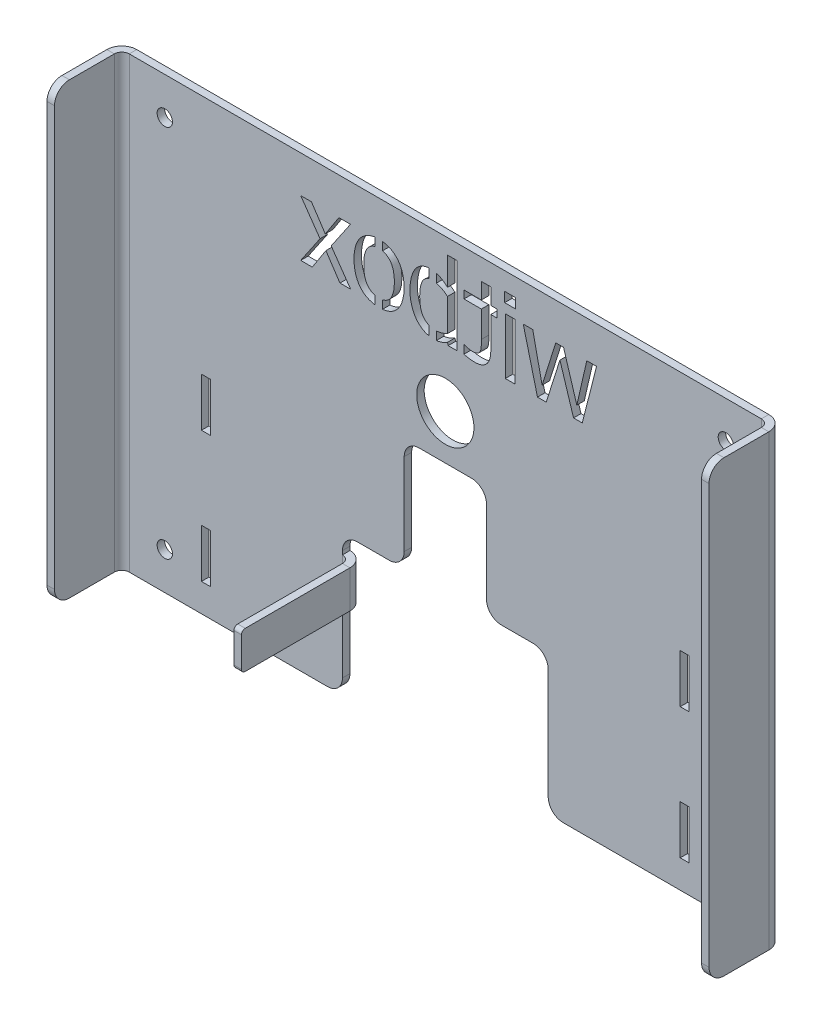
from build123d import *
from build123d.topology import SkipClean

# Parameters (mm, degrees)
SKETCH1_W                = 210.425
SKETCH1_H                = 120
BOSS_EXTRUDE1_DEPTH      = 2
FILLET1_R                = 4
CUT_EXTRUDE1_DEPTH       = 2
SKETCH3_R                = 2.05
SKETCH3_R_2              = 7.65
SKETCH3_W                = 2.4
SKETCH3_H                = 13
CUT_EXTRUDE2_DEPTH       = 2
SKETCHED_START           = -105.2125
SKETCHED_BEND1_OUTLINE_W = 120
SKETCHED_BEND1_OUTLINE_H = 2
SKETCHED_BEND1_DEPTH     = 17.09002
SKETCHED_START_2         = -86.52248
SKETCHED_BEND1_2_DEPTH   = 0.02248
SKETCHED_START_3         = -88.5
SKETCHED_BEND1_3_DEPTH   = 4
SKETCHED_START_4         = -60
SKETCHED_BEND1_4_DEPTH   = 121
SKETCHED_START_5         = 88.07752
SKETCHED_BEND2_OUTLINE_W = 120
SKETCHED_BEND2_OUTLINE_H = 2
SKETCHED_BEND2_DEPTH     = 17.13498
SKETCHED_START_6         = 86.5
SKETCHED_BEND2_2_DEPTH   = 0.26106225
SKETCHED_START_7         = 84.5
SKETCHED_BEND2_3_DEPTH   = 4
SKETCHED_BEND2_4_DEPTH   = 121
SKETCHED_START_8         = -37.5
SKETCHED_BEND3_DEPTH     = 10
SKETCHED_START_9         = -36.5
SKETCHED_BEND3_2_DEPTH   = 8
SKETCHED_START_10        = -27.12248
SKETCHED_BEND3_3_DEPTH   = 3.62248
SKETCHED_START_11        = -27.5
SKETCHED_BEND3_4_DEPTH   = 1.974011807
SKETCHED_BEND3_5_DEPTH   = 10
SKETCHED_START_12        = -28.5
SKETCHED_BEND3_6_DEPTH   = 1
SKETCH14_W               = 2.528363047
SKETCH14_H               = 15.008103727
SKETCH14_W_2             = 2.868719611
SKETCH14_H_2             = 2.625607779
CUT_EXTRUDE3_DEPTH       = 2
CUT_EXTRUDE4_START       = -2
CUT_EXTRUDE4_DEPTH       = 2


with BuildPart() as part:
    # Sketch1 → Boss-Extrude1 (new body)
    with BuildSketch(Plane.XY):
        Rectangle(SKETCH1_W, SKETCH1_H)
    extrude(amount=BOSS_EXTRUDE1_DEPTH)

    # Fillet1
    fillet1_edges = [part.edges().sort_by_distance(p)[0] for p in [
        (-105.2125, -60, 1),
        (-105.2125, 60, 1),
        (105.2125, 60, 1),
        (105.2125, -60, 1),
    ]]
    fillet(fillet1_edges, radius=FILLET1_R)

    # Sketch2 → Cut-Extrude1 (cut)
    with BuildSketch(Plane.XY.offset(2)):
        with BuildLine():
            ThreePointArc((27.5, -56), (28.671572875, -58.828427125), (31.5, -60))
            Line((31.5, -60), (-31.5, -60))
            ThreePointArc((-31.5, -60), (-28.671572875, -58.828427125), (-27.5, -56))
            Line((-27.5, -56), (-27.5, -37.5))
            Line((-27.5, -37.5), (5.21238898, -37.5))
            ThreePointArc((5.21238898, -37.5), (5.919495761, -37.207106781), (6.21238898, -36.5))
            Line((6.21238898, -36.5), (6.21238898, -28.5))
            ThreePointArc((6.21238898, -28.5), (5.919495761, -27.792893219), (5.21238898, -27.5))
            Line((5.21238898, -27.5), (-27.5, -27.5))
            Line((-27.5, -27.5), (-27.5, -26.5))
            ThreePointArc((-27.5, -26.5), (-26.328427125, -23.671572875), (-23.5, -22.5))
            Line((-23.5, -22.5), (-13.165, -22.5))
            ThreePointArc((-13.165, -22.5), (-10.336572875, -21.328427125), (-9.165, -18.5))
            Line((-9.165, -18.5), (-9.165, 3.5))
            ThreePointArc((-9.165, 3.5), (-7.993427125, 6.328427125), (-5.165, 7.5))
            Line((-5.165, 7.5), (5.165, 7.5))
            ThreePointArc((5.165, 7.5), (7.993427125, 6.328427125), (9.165, 3.5))
            Line((9.165, 3.5), (9.165, -18.5))
            ThreePointArc((9.165, -18.5), (10.336572875, -21.328427125), (13.165, -22.5))
            Line((13.165, -22.5), (23.5, -22.5))
            ThreePointArc((23.5, -22.5), (26.328427125, -23.671572875), (27.5, -26.5))
            Line((27.5, -26.5), (27.5, -56))
        make_face()
    extrude(amount=-CUT_EXTRUDE1_DEPTH, mode=Mode.SUBTRACT)

    # Sketch3 → Cut-Extrude2 (cut)
    with BuildSketch(Plane.XY.offset(2)):
        with Locations((-75, 50)):
            Circle(SKETCH3_R)
        with Locations((-75, -50)):
            Circle(SKETCH3_R)
        with Locations((0, 19.5)):
            Circle(SKETCH3_R_2)
        with Locations((75, 50)):
            Circle(SKETCH3_R)
        with Locations((75, -50)):
            Circle(SKETCH3_R)
        with Locations((-64, -46)):
            Rectangle(SKETCH3_W, SKETCH3_H)
        with Locations((-64, -11)):
            Rectangle(SKETCH3_W, SKETCH3_H)
        with Locations((64, -11)):
            Rectangle(SKETCH3_W, SKETCH3_H)
        with Locations((64, -46)):
            Rectangle(SKETCH3_W, SKETCH3_H)
    extrude(amount=-CUT_EXTRUDE2_DEPTH, mode=Mode.SUBTRACT)

    # Sketched Bend1: read off the stored shape, not the designer's step
    # Sketched Bend1 outline → Sketched Bend1 (cut)
    with BuildSketch(Plane.YZ.offset(SKETCHED_START)):
        with Locations((0, 1)):
            Rectangle(SKETCHED_BEND1_OUTLINE_W, SKETCHED_BEND1_OUTLINE_H)
    extrude(amount=SKETCHED_BEND1_DEPTH, mode=Mode.SUBTRACT)

    # Sketched Bend1 2 outline → Sketched Bend1 2 (add)
    with BuildSketch(Plane.YZ.offset(SKETCHED_START_2)):
        with BuildLine():
            Line((60, 2), (60, 16.00011102))
            ThreePointArc((60, 16.00011102), (58.828427124, 18.828538144), (56, 20.00011102))
            Line((56, 20.00011102), (-56, 20.00011102))
            ThreePointArc((-56, 20.00011102), (-58.828427124, 18.828538144), (-60, 16.00011102))
            Line((-60, 16.00011102), (-60, 2))
            Line((-60, 2), (60, 2))
        make_face()
    extrude(amount=SKETCHED_BEND1_2_DEPTH)

    # Sketched Bend1 3 outline → Sketched Bend1 3 (add)
    with BuildSketch(Plane.YZ.offset(SKETCHED_START_3)):
        with BuildLine():
            Line((60, 2), (60, 16.00011102))
            ThreePointArc((60, 16.00011102), (58.828427124, 18.828538144), (56, 20.00011102))
            Line((56, 20.00011102), (-56, 20.00011102))
            ThreePointArc((-56, 20.00011102), (-58.828427124, 18.828538144), (-60, 16.00011102))
            Line((-60, 16.00011102), (-60, 2))
            Line((-60, 2), (60, 2))
        make_face()
    extrude(amount=SKETCHED_BEND1_3_DEPTH)

    # Sketched Bend1 4 outline → Sketched Bend1 4 (cut)
    with BuildSketch(Plane(origin=(0, 0, 0), x_dir=(1, 0, 0), z_dir=(0, 1, 0)).offset(SKETCHED_START_4)):
        with BuildLine():
            Line((-86.5, -4), (-86.5, -20.00011102))
            Line((-86.5, -20.00011102), (-84.5, -20.00011102))
            Line((-84.5, -20.00011102), (-84.5, -2))
            ThreePointArc((-84.5, -2), (-85.914213562, -2.585786438), (-86.5, -4))
        make_face()
        with BuildLine():
            Line((-88.5, -2), (-88.5, -4))
            ThreePointArc((-88.5, -4), (-87.328427125, -1.171572875), (-84.5, 0))
            Line((-84.5, 0), (-88.12248, 0))
            Line((-88.12248, 0), (-88.12248, -2))
            Line((-88.12248, -2), (-88.5, -2))
        make_face()
    extrude(amount=SKETCHED_BEND1_4_DEPTH, mode=Mode.SUBTRACT)

    # Sketched Bend2: read off the stored shape, not the designer's step
    # Sketched Bend2 outline → Sketched Bend2 (cut)
    with BuildSketch(Plane.YZ.offset(SKETCHED_START_5)):
        with Locations((0, 1)):
            Rectangle(SKETCHED_BEND2_OUTLINE_W, SKETCHED_BEND2_OUTLINE_H)
    extrude(amount=SKETCHED_BEND2_DEPTH, mode=Mode.SUBTRACT)

    # Sketched Bend2 2 outline → Sketched Bend2 2 (add)
    with BuildSketch(Plane.YZ.offset(SKETCHED_START_6)):
        with BuildLine():
            Line((60, 2), (60, 16.00011102))
            ThreePointArc((60, 16.00011102), (58.828427124, 18.828538144), (56, 20.00011102))
            Line((56, 20.00011102), (-56, 20.00011102))
            ThreePointArc((-56, 20.00011102), (-58.828427124, 18.828538144), (-60, 16.00011102))
            Line((-60, 16.00011102), (-60, 2))
            Line((-60, 2), (60, 2))
        make_face()
    extrude(amount=SKETCHED_BEND2_2_DEPTH)

    # Sketched Bend2 3 outline → Sketched Bend2 3 (add)
    with BuildSketch(Plane.YZ.offset(SKETCHED_START_7)):
        with BuildLine():
            Line((60, 2), (60, 16.00011102))
            ThreePointArc((60, 16.00011102), (58.828427124, 18.828538144), (56, 20.00011102))
            Line((56, 20.00011102), (-56, 20.00011102))
            ThreePointArc((-56, 20.00011102), (-58.828427124, 18.828538144), (-60, 16.00011102))
            Line((-60, 16.00011102), (-60, 2))
            Line((-60, 2), (60, 2))
        make_face()
    extrude(amount=SKETCHED_BEND2_3_DEPTH)

    # Sketched Bend2 4 outline → Sketched Bend2 4 (cut)
    with BuildSketch(Plane(origin=(0, 0, 0), x_dir=(1, 0, 0), z_dir=(0, 1, 0)).offset(SKETCHED_START_4)):
        with BuildLine():
            Line((86.5, -20.00011102), (86.5, -4))
            ThreePointArc((86.5, -4), (85.914213562, -2.585786438), (84.5, -2))
            Line((84.5, -2), (84.5, -20.00011102))
            Line((84.5, -20.00011102), (86.5, -20.00011102))
        make_face()
        with BuildLine():
            ThreePointArc((84.5, 0), (87.328427125, -1.171572875), (88.5, -4))
            Line((88.5, -4), (88.5, -2))
            Line((88.5, -2), (88.07752, -2))
            Line((88.07752, -2), (88.07752, 0))
            Line((88.07752, 0), (84.5, 0))
        make_face()
    extrude(amount=SKETCHED_BEND2_4_DEPTH, mode=Mode.SUBTRACT)

    # Sketched Bend3: read off the stored shape, not the designer's step
    # Sketched Bend3 outline → Sketched Bend3 (cut)
    with BuildSketch(Plane(origin=(0, 0, 0), x_dir=(1, 0, 0), z_dir=(0, 1, 0)).offset(SKETCHED_START_8)):
        with BuildLine():
            ThreePointArc((-27.5, 0), (-25.5, -0.535898385), (-24.035898384, -2))
            Line((-24.035898384, -2), (6.21238898, -2))
            Line((6.21238898, -2), (6.21238898, 0))
            Line((6.21238898, 0), (-27.5, 0))
        make_face()
    extrude(amount=SKETCHED_BEND3_DEPTH, mode=Mode.SUBTRACT)

    # Sketched Bend3 2 outline → Sketched Bend3 2 (add)
    with BuildSketch(Plane(origin=(0, 0, 0), x_dir=(1, 0, 0), z_dir=(0, 1, 0)).offset(SKETCHED_START_9)):
        with BuildLine():
            ThreePointArc((-27.5, -2), (-26.085786438, -2.585786438), (-25.5, -4))
            Line((-25.5, -4), (-25.5, -33))
            Line((-25.5, -33), (-23.5, -33))
            Line((-23.5, -33), (-23.5, -4))
            ThreePointArc((-23.5, -4), (-23.636296695, -2.96472382), (-24.035898384, -2))
            Line((-24.035898384, -2), (-27.5, -2))
        make_face()
    extrude(amount=SKETCHED_BEND3_2_DEPTH)

    # Sketched Bend3 3 outline → Sketched Bend3 3 (add)
    with BuildSketch(Plane.YZ.offset(SKETCHED_START_10)):
        with BuildLine():
            Line((-28.5, 33), (-28.5, 2))
            Line((-28.5, 2), (-27.5, 2))
            Line((-27.5, 2), (-27.5, 32))
            ThreePointArc((-27.5, 32), (-27.792893219, 32.707106781), (-28.5, 33))
        make_face()
        with BuildLine():
            Line((-37.5, 32), (-37.5, 2))
            Line((-37.5, 2), (-36.5, 2))
            Line((-36.5, 2), (-36.5, 33))
            ThreePointArc((-36.5, 33), (-37.207106781, 32.707106781), (-37.5, 32))
        make_face()
    extrude(amount=SKETCHED_BEND3_3_DEPTH)

    # Sketched Bend3 4 outline → Sketched Bend3 4 (add)
    with BuildSketch(Plane.YZ.offset(SKETCHED_START_11)):
        with BuildLine():
            Line((-37.5, 32), (-37.5, 2))
            Line((-37.5, 2), (-36.5, 2))
            Line((-36.5, 2), (-36.5, 33))
            ThreePointArc((-36.5, 33), (-37.207106781, 32.707106781), (-37.5, 32))
        make_face()
    extrude(amount=SKETCHED_BEND3_4_DEPTH)

    # Sketched Bend3 5 outline → Sketched Bend3 5 (cut)
    with SkipClean():  # the faces are left unmerged after this step: merging them gives an invalid solid
        with BuildSketch(Plane(origin=(0, 0, 0), x_dir=(1, 0, 0), z_dir=(0, 1, 0)).offset(SKETCHED_START_8)):
            with BuildLine():
                Line((-27.5, -2), (-27.5, -33))
                Line((-27.5, -33), (-25.5, -33))
                Line((-25.5, -33), (-25.5, -4))
                ThreePointArc((-25.5, -4), (-26.085786438, -2.585786438), (-27.5, -2))
            make_face()
            with BuildLine():
                Line((-23.5, -2), (-24.035898384, -2))
                ThreePointArc((-24.035898384, -2), (-23.636296695, -2.96472382), (-23.5, -4))
                Line((-23.5, -4), (-23.5, -2))
            make_face()
        extrude(amount=SKETCHED_BEND3_5_DEPTH, mode=Mode.SUBTRACT)
    add(part.part.scale(1), mode=Mode.REPLACE)  # the faces are merged on a copy

    # Sketched Bend3 6 outline → Sketched Bend3 6 (add)
    with BuildSketch(Plane(origin=(0, 0, 0), x_dir=(1, 0, 0), z_dir=(0, 1, 0)).offset(SKETCHED_START_12)):
        with BuildLine():
            Line((-27.12248, -2), (-27.5, -2))
            ThreePointArc((-27.5, -2), (-27.310385915, -2.009008664), (-27.12248, -2.035953501))
            Line((-27.12248, -2.035953501), (-27.12248, -2))
        make_face()
    extrude(amount=SKETCHED_BEND3_6_DEPTH)

    # Sketch14 → Cut-Extrude3 (cut)
    with BuildSketch(Plane(origin=(0, 0, 0), x_dir=(-1, 0, 0), z_dir=(0, 0, -1))):
        Polygon((38.666027644, 35.1), (33.495849362, 42.701296596), (38.666027644, 50.108103727), (35.797308033, 50.108103727), (32.08580074, 44.516531604), (28.455330724, 50.108103727), (25.359706737, 50.108103727), (30.513677563, 42.539222042), (25.31108437, 35.1), (28.179803981, 35.1), (31.923726186, 40.740194489), (35.570403657, 35.1), align=None)
        with BuildLine():
            Line((18.803594186, 50.450465745), (18.803594186, 48.242394788))
            add(Edge.make_bspline(
                [(18.803594186, 48.242394788), (19.0843933, 48.163795397), (19.35238552, 48.057872818), (19.858515566, 47.782441204), (20.098399435, 47.610015527), (20.51913856, 47.217183621), (20.704515164, 46.994363177), (21.025013523, 46.508529826), (21.156333975, 46.252435323), (21.375843735, 45.7205989), (21.464321072, 45.442972018), (21.605272017, 44.88217588), (21.657922196, 44.599647691), (21.737636937, 44.031533834), (21.764587503, 43.745934543), (21.800210995, 43.172551787), (21.809843108, 42.884882943), (21.810677133, 42.307342849), (21.801854272, 42.019698596), (21.769582366, 41.446841733), (21.745003028, 41.161673612), (21.634478315, 40.311660256), (21.514837505, 39.750420065), (21.19168841, 38.9343494), (21.062117014, 38.674421104), (20.745095573, 38.186596368), (20.555993565, 37.959027851), (20.236254525, 37.667285715), (20.12317235, 37.577402472), (19.88350737, 37.412925578), (19.756001508, 37.338000097), (19.364830302, 37.142494038), (19.089973353, 37.048603365), (18.803594182, 36.984632637)],
                knots=[0, 0, 0, 0, 0.000862796, 0.000862796, 0.001725592, 0.001725592, 0.002588387, 0.002588387, 0.003451183, 0.003451183, 0.004313979, 0.004313979, 0.005176775, 0.005176775, 0.006039571, 0.006039571, 0.006902366, 0.006902366, 0.007765162, 0.007765162, 0.008627958, 0.008627958, 0.01035355, 0.01035355, 0.011216345, 0.011216345, 0.012079141, 0.012079141, 0.012510539, 0.012510539, 0.012941937, 0.012941937, 0.013804733, 0.013804733, 0.013804733, 0.013804733], degree=3))
            Line((18.803594182, 36.984632637), (18.803594182, 34.721097005))
            add(Edge.make_bspline(
                [(18.803594182, 34.721097005), (19.244023375, 34.794628319), (19.673560319, 34.900185006), (20.297683584, 35.117629302), (20.502351301, 35.20000172), (20.904098474, 35.386995931), (21.102428387, 35.492415338), (21.674437548, 35.840263751), (22.023130184, 36.112174944), (22.495941855, 36.581600791), (22.645993653, 36.749496256), (22.923416352, 37.098580413), (23.051231114, 37.279927819), (23.286988217, 37.655033704), (23.394928107, 37.848793714), (23.592536104, 38.247725147), (23.682408891, 38.453628739), (23.922759272, 39.075946003), (24.046073118, 39.499957713), (24.236859108, 40.361795751), (24.304160494, 40.79970131), (24.39460459, 41.686288558), (24.419350678, 42.128181316), (24.419991791, 43.008624679), (24.395730641, 43.447164599), (24.307468742, 44.321525647), (24.241333564, 44.757200747), (24.049371934, 45.624467161), (23.922994393, 46.055480238), (23.601561601, 46.881239913), (23.405607108, 47.280056588), (22.926733649, 48.037632109), (22.651797905, 48.38342759), (22.183705451, 48.850364395), (22.018385986, 48.99737726), (21.668673911, 49.273676681), (21.483942064, 49.402928303), (20.916604748, 49.754687331), (20.516253751, 49.945375919), (19.678135947, 50.252656755), (19.242471363, 50.367923945), (18.803594186, 50.450465745)],
                knots=[0, 0, 0, 0, 0.001321806, 0.001321806, 0.00198271, 0.00198271, 0.002643613, 0.002643613, 0.003965419, 0.003965419, 0.004626322, 0.004626322, 0.005287226, 0.005287226, 0.005948129, 0.005948129, 0.006609032, 0.006609032, 0.007930838, 0.007930838, 0.009252645, 0.009252645, 0.010574451, 0.010574451, 0.011896258, 0.011896258, 0.013218064, 0.013218064, 0.014539871, 0.014539871, 0.015861677, 0.015861677, 0.017183483, 0.017183483, 0.017844387, 0.017844387, 0.01850529, 0.01850529, 0.019827096, 0.019827096, 0.021148903, 0.021148903, 0.021148903, 0.021148903], degree=3))
        make_face()
        with BuildLine():
            Line((16.803594209, 48.242394784), (16.803594209, 50.450465743))
            add(Edge.make_bspline(
                [(16.803594209, 50.450465743), (16.355904459, 50.379965428), (15.91906517, 50.276666089), (15.283663794, 50.06191434), (15.075181752, 49.980325882), (14.665637711, 49.794778626), (14.463358558, 49.69007026), (13.878524373, 49.343789444), (13.520923552, 49.072652549), (13.034027025, 48.604185577), (12.87910802, 48.436582554), (12.591214863, 48.086940316), (12.458177275, 47.905178054), (12.212089284, 47.528936141), (12.099041328, 47.334454932), (11.89144995, 46.9337185), (11.796555629, 46.726475457), (11.541643144, 46.098349249), (11.409927322, 45.669873413), (11.205762136, 44.797843767), (11.133449351, 44.354255211), (11.038143554, 43.454530662), (11.015487023, 43.005816845), (11.01675591, 42.111903178), (11.040726258, 41.666468212), (11.138075038, 40.778820464), (11.211530073, 40.336612677), (11.419510959, 39.456179881), (11.553106521, 39.02338731), (11.803805866, 38.397852415), (11.895914123, 38.192823531), (12.099332718, 37.790595021), (12.211214424, 37.592506955), (12.575750263, 37.018250415), (12.85430852, 36.665635283), (13.333222181, 36.188658963), (13.504385786, 36.037400623), (13.862108894, 35.759044083), (14.047939873, 35.632217679), (14.433077468, 35.402447655), (14.632385067, 35.299505776), (15.044127654, 35.116887607), (15.257799514, 35.036871484), (15.907400308, 34.83410402), (16.351178919, 34.747749136), (16.80359421, 34.70094464)],
                knots=[0, 0, 0, 0, 0.001341401, 0.001341401, 0.002012101, 0.002012101, 0.002682801, 0.002682801, 0.004024202, 0.004024202, 0.004694902, 0.004694902, 0.005365602, 0.005365602, 0.006036302, 0.006036302, 0.006707003, 0.006707003, 0.008048403, 0.008048403, 0.009389804, 0.009389804, 0.010731204, 0.010731204, 0.012072605, 0.012072605, 0.013414005, 0.013414005, 0.014755406, 0.014755406, 0.015426106, 0.015426106, 0.016096806, 0.016096806, 0.017438207, 0.017438207, 0.018108907, 0.018108907, 0.018779607, 0.018779607, 0.019450308, 0.019450308, 0.020121008, 0.020121008, 0.021462408, 0.021462408, 0.021462408, 0.021462408], degree=3))
            Line((16.80359421, 34.70094464), (16.80359421, 36.9138962))
            add(Edge.make_bspline(
                [(16.80359421, 36.9138962), (16.513499633, 36.980589184), (16.235460475, 37.076518617), (15.707725764, 37.336969373), (15.45676373, 37.504197293), (15.125610631, 37.794485191), (15.021709927, 37.898169643), (14.82627298, 38.118738583), (14.734201106, 38.236454211), (14.480514918, 38.601310518), (14.34075505, 38.859512537), (14.105333296, 39.398389588), (14.00946318, 39.680956314), (13.856087393, 40.249298573), (13.797783952, 40.536406922), (13.708376022, 41.114969101), (13.677369903, 41.406438648), (13.636231348, 41.992712655), (13.625381332, 42.288196116), (13.62563896, 42.876080668), (13.636150916, 43.169059702), (13.673220063, 43.753529259), (13.70121474, 44.044886426), (13.827287883, 44.915053332), (13.968334315, 45.496990652), (14.324400541, 46.305414269), (14.46976379, 46.567757699), (14.811024576, 47.045237293), (15.007027103, 47.262133251), (15.344208093, 47.550304287), (15.464087326, 47.640116128), (15.710770774, 47.8017897), (15.838443766, 47.874472268), (16.23354582, 48.069771891), (16.514558847, 48.169876547), (16.803594209, 48.242394784)],
                knots=[0, 0, 0, 0, 0.000880788, 0.000880788, 0.001761575, 0.001761575, 0.002201969, 0.002201969, 0.002642363, 0.002642363, 0.00352315, 0.00352315, 0.004403938, 0.004403938, 0.005284725, 0.005284725, 0.006165513, 0.006165513, 0.0070463, 0.0070463, 0.007927088, 0.007927088, 0.008807875, 0.008807875, 0.010569451, 0.010569451, 0.011450238, 0.011450238, 0.012331026, 0.012331026, 0.012771419, 0.012771419, 0.013211813, 0.013211813, 0.014092601, 0.014092601, 0.014092601, 0.014092601], degree=3))
        make_face()
        with BuildLine():
            Line((4.379745658, 50.490522969), (4.379745658, 47.983167135))
            add(Edge.make_bspline(
                [(4.379745658, 47.983167135), (4.639533343, 47.919691396), (4.883857258, 47.820043696), (5.337834288, 47.539742838), (5.537845525, 47.364490326), (5.885012944, 46.96162388), (6.029473708, 46.737621346), (6.270769805, 46.269247999), (6.369587897, 46.020885502), (6.612142332, 45.266100954), (6.706035416, 44.749370843), (6.795122287, 43.963941581), (6.815631107, 43.699852628), (6.842905872, 43.172971974), (6.850391654, 42.909704), (6.851162672, 42.383565916), (6.844390462, 42.120697417), (6.818622832, 41.595302882), (6.798788446, 41.332800352), (6.737853926, 40.808391108), (6.696586852, 40.545726971), (6.58604744, 40.029783078), (6.516808476, 39.77572042), (6.3409344, 39.278060392), (6.233233676, 39.033066854), (5.976540273, 38.573367734), (5.827222888, 38.356969396), (5.477876472, 37.956700681), (5.281695116, 37.778171154), (4.856463176, 37.471870763), (4.625431884, 37.342333843), (4.379745666, 37.236349743)],
                knots=[0, 0, 0, 0, 0.000791458, 0.000791458, 0.001582916, 0.001582916, 0.002374374, 0.002374374, 0.003165832, 0.003165832, 0.004748748, 0.004748748, 0.005540206, 0.005540206, 0.006331664, 0.006331664, 0.007123121, 0.007123121, 0.007914579, 0.007914579, 0.008706037, 0.008706037, 0.009497495, 0.009497495, 0.010288953, 0.010288953, 0.011080411, 0.011080411, 0.011871869, 0.011871869, 0.012663327, 0.012663327, 0.012663327, 0.012663327], degree=3))
            Line((4.379745666, 37.236349743), (4.379745666, 34.781100312))
            add(Edge.make_bspline(
                [(4.379745666, 34.781100312), (4.801463145, 34.875284194), (5.20559235, 35.012312202), (5.976443188, 35.377361253), (6.346535244, 35.609135775), (7.01404464, 36.142673701), (7.315624765, 36.445162124), (7.8604967, 37.114849294), (8.09554976, 37.47169319), (8.504268573, 38.218230726), (8.678352192, 38.608981157), (8.972789636, 39.417544939), (9.090375756, 39.827311512), (9.27634902, 40.655950871), (9.34465483, 41.074838711), (9.436047455, 41.92098395), (9.458763892, 42.350285385), (9.461489563, 43.206428127), (9.441916746, 43.632238882), (9.36690243, 44.479987321), (9.311032459, 44.901878738), (9.153614004, 45.740729243), (9.05130237, 46.160126827), (8.790329862, 46.975579738), (8.632032355, 47.37238334), (8.337850314, 47.945305798), (8.229923404, 48.132776341), (7.99635111, 48.49123678), (7.870286039, 48.663156135), (7.597260277, 48.990531187), (7.450307374, 49.145993021), (7.132470099, 49.438061082), (6.964225286, 49.572010969), (6.61335484, 49.812105207), (6.430073383, 49.918859787), (6.04786537, 50.105864124), (5.847708297, 50.186490752), (5.23235751, 50.38588741), (4.810542653, 50.460850336), (4.379745658, 50.490522969)],
                knots=[0, 0, 0, 0, 0.001277624, 0.001277624, 0.002555247, 0.002555247, 0.003832871, 0.003832871, 0.005110494, 0.005110494, 0.006388118, 0.006388118, 0.007665741, 0.007665741, 0.008943365, 0.008943365, 0.010220989, 0.010220989, 0.011498612, 0.011498612, 0.012776236, 0.012776236, 0.014053859, 0.014053859, 0.015331483, 0.015331483, 0.015970295, 0.015970295, 0.016609106, 0.016609106, 0.017247918, 0.017247918, 0.01788673, 0.01788673, 0.018525542, 0.018525542, 0.019164353, 0.019164353, 0.020441977, 0.020441977, 0.020441977, 0.020441977], degree=3))
        make_face()
        with BuildLine():
            Line((-0.588429406, 48.508815062), (-0.588429406, 55.96424456))
            Line((-0.588429406, 55.96424456), (-3.116792453, 55.96424456))
            Line((-3.116792453, 55.96424456), (-3.116792453, 35.072834512))
            Line((-3.116792453, 35.072834512), (-0.750503927, 35.072834512))
            Line((-0.750503927, 35.072834512), (-0.588429402, 35.769755105))
            add(Edge.make_bspline(
                [(-0.588429402, 35.769755105), (-0.134554359, 35.494195186), (0.340558721, 35.248929254), (1.331468017, 34.868294372), (1.850241907, 34.732329614), (2.379745723, 34.689740221)],
                knots=[0, 0, 0, 0, 0.001593917, 0.001593917, 0.003187835, 0.003187835, 0.003187835, 0.003187835], degree=3))
            Line((2.379745723, 34.689740221), (2.379745723, 36.927972061))
            add(Edge.make_bspline(
                [(2.379745723, 36.927972061), (1.3364304, 36.953824484), (0.336629659, 37.321196614), (-0.588429406, 37.779479576)],
                knots=[0, 0, 0, 0, 0.003108941, 0.003108941, 0.003108941, 0.003108941], degree=3))
            Line((-0.588429406, 37.779479576), (-0.588429409, 46.385638412))
            add(Edge.make_bspline(
                [(-0.588429409, 46.385638412), (0.90330324, 47.6305523), (2.379745682, 47.984478382)],
                knots=[0, 0, 0, 1, 1, 1], degree=2))
            Line((2.379745682, 47.984478382), (2.379745664, 50.288467643))
            add(Edge.make_bspline(
                [(2.379745664, 50.288467643), (1.088367971, 49.926663265), (-0.588429406, 48.508815062)],
                knots=[0, 0, 0, 1, 1, 1], degree=2))
        make_face()
        with BuildLine():
            Line((-4.980649827, 50.080938239), (-9.632189536, 50.080938239))
            Line((-9.632189536, 50.080938239), (-9.632189536, 54.392121384))
            Line((-9.632189536, 54.392121384), (-12.160552583, 54.392121384))
            Line((-12.160552583, 54.392121384), (-12.160552583, 50.080938239))
            Line((-12.160552583, 50.080938239), (-13.862335403, 50.080938239))
            Line((-13.862335403, 50.080938239), (-13.862335403, 47.990176489))
            Line((-13.862335403, 47.990176489), (-12.160552583, 47.990176489))
            Line((-12.160552583, 47.990176489), (-12.160552583, 39.563309134))
            add(Edge.make_bspline(
                [(-12.160552583, 39.563309134), (-12.160552582, 39.134604894), (-12.132226128, 38.709580395), (-12.028442322, 38.080202383), (-11.983530311, 37.871774535), (-11.86769636, 37.458359521), (-11.797047826, 37.255022436), (-11.628052429, 36.863520783), (-11.529467853, 36.674358403), (-11.29857885, 36.31180445), (-11.167246389, 36.14071307), (-10.878461721, 35.829536203), (-10.720099773, 35.687945557), (-10.374549162, 35.433649119), (-10.188681203, 35.322424472), (-9.613057243, 35.042210383), (-9.193945362, 34.921392089), (-8.3538787, 34.787211673), (-7.926231904, 34.770532402), (-7.070181481, 34.802831558), (-6.647344448, 34.851684101), (-5.808616464, 34.993172841), (-5.392630587, 35.085652338), (-4.980649803, 35.202494162)],
                knots=[0, 0, 0, 0, 0.001275106, 0.001275106, 0.001912659, 0.001912659, 0.002550211, 0.002550211, 0.003187764, 0.003187764, 0.003825317, 0.003825317, 0.00446287, 0.00446287, 0.005100423, 0.005100423, 0.006375528, 0.006375528, 0.007650634, 0.007650634, 0.00892574, 0.00892574, 0.010200846, 0.010200846, 0.010200846, 0.010200846], degree=3))
            Line((-4.980649803, 35.202494162), (-4.980649803, 37.471537917))
            Line((-4.980649803, 37.471537917), (-5.126516909, 37.471537917))
            add(Edge.make_bspline(
                [(-5.126516909, 37.471537917), (-5.42185762, 37.359093247), (-5.716612255, 37.244762469), (-6.320635438, 37.071297925), (-6.629955901, 37.012541464), (-7.109268272, 36.983091086), (-7.268853759, 36.982472253), (-7.586970253, 36.996821349), (-7.745630574, 37.011917851), (-8.061824976, 37.064532101), (-8.216827257, 37.101597965), (-8.516871588, 37.206596715), (-8.664017494, 37.275888144), (-8.928125338, 37.454243465), (-9.047672966, 37.566312049), (-9.233495675, 37.824182669), (-9.302246882, 37.971284351), (-9.4728646, 38.418036866), (-9.544981831, 38.730813582), (-9.623631503, 39.363921372), (-9.632536065, 39.681575815), (-9.636731485, 40.317377221), (-9.632189536, 40.635531383), (-9.632189536, 40.953494732)],
                knots=[0, 0, 0, 0, 0.000942383, 0.000942383, 0.001884765, 0.001884765, 0.002355956, 0.002355956, 0.002827148, 0.002827148, 0.003298339, 0.003298339, 0.00376953, 0.00376953, 0.004240722, 0.004240722, 0.004711913, 0.004711913, 0.005654295, 0.005654295, 0.006596678, 0.006596678, 0.007539061, 0.007539061, 0.007539061, 0.007539061], degree=3))
            Line((-9.632189536, 40.953494732), (-9.632189536, 47.990176489))
            Line((-9.632189536, 47.990176489), (-4.980649827, 47.990176489))
            Line((-4.980649827, 47.990176489), (-4.980649827, 50.080938239))
        make_face()
        with Locations((-17.298315954, 42.604051864)):
            Rectangle(SKETCH14_W, SKETCH14_H)
        with Locations((-17.290212227, 53.889690266)):
            Rectangle(SKETCH14_W_2, SKETCH14_H_2)
        Polygon((-20.831541237, 50.108103727), (-23.37611174, 50.108103727), (-25.872059876, 38.487358184), (-29.518737348, 50.108103727), (-31.609499098, 50.108103727), (-35.158931837, 38.487358184), (-37.816954528, 50.108103727), (-40.442562307, 50.108103727), (-36.60139537, 35.1), (-34.283729244, 35.1), (-30.637051772, 46.672123176), (-26.974166845, 35.1), (-24.640293263, 35.1), align=None)
    extrude(amount=-CUT_EXTRUDE3_DEPTH, mode=Mode.SUBTRACT)

    # Sketch15 → Cut-Extrude4 (cut)
    with BuildSketch(Plane.XY.offset(2).offset(CUT_EXTRUDE4_START)):
        with BuildLine():
            Line((-11, -18.5), (-11, 3.5))
            ThreePointArc((-11, 3.5), (-9.828427125, 6.328427125), (-7, 7.5))
            Line((-7, 7.5), (7, 7.5))
            ThreePointArc((7, 7.5), (9.828427125, 6.328427125), (11, 3.5))
            Line((11, 3.5), (11, -18.5))
            ThreePointArc((11, -18.5), (12.171572875, -21.328427125), (15, -22.5))
            Line((15, -22.5), (-15, -22.5))
            ThreePointArc((-15, -22.5), (-12.171572875, -21.328427125), (-11, -18.5))
        make_face()
    extrude(amount=CUT_EXTRUDE4_DEPTH, mode=Mode.SUBTRACT)


solid = part.part
